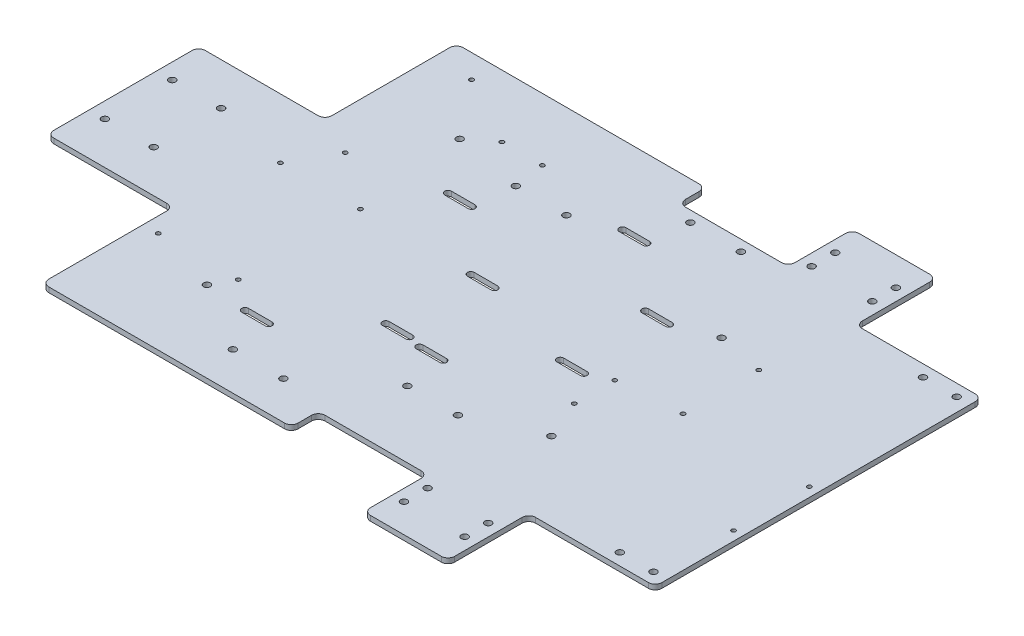
from build123d import *

# Parameters (mm, degrees)
SALIENTE_EXTRUIR1_DEPTH       = 3
REDONDEO1_R                   = 4
CROQUIS4_R                    = 2
CORTAR_EXTRUIR1_DEPTH         = 10
CROQUIS5_R                    = 2
CORTAR_EXTRUIR2_DEPTH         = 10
TALADRO_ROSCADO_M31_D         = 2.5
TALADRO_ROSCADO_M31_DEPTH     = 8.5
TALADRO_ROSCADO_M31_TIP       = 0.751075774
CROQUIS13_R                   = 2
CORTAR_EXTRUIR6_DEPTH         = 438.724799389
CROQUIS14_R                   = 2
CORTAR_EXTRUIR7_DEPTH         = 438.724799389
CORTAR_EXTRUIR9_DEPTH         = 438.724799389
TALADRO_ROSCADO_M32_D         = 2.5
TALADRO_ROSCADO_M32_DEPTH     = 8.5
TALADRO_ROSCADO_M32_TIP       = 0.751075774
TALADRO_ROSCADO_M33_OUTLINE_R = 1.25
TALADRO_ROSCADO_M33_DEPTH     = 3
CROQUIS22_R                   = 2
CORTAR_EXTRUIR10_DEPTH        = 438.724799389
CROQUIS23_R                   = 2
CORTAR_EXTRUIR11_DEPTH        = 438.724799389
TALADRO_ROSCADO_M34_OUTLINE_R = 1.25
TALADRO_ROSCADO_M34_DEPTH     = 3
CROQUIS26_R                   = 2
CORTAR_EXTRUIR12_DEPTH        = 438.724799389
TALADRO_ROSCADO_M35_OUTLINE_R = 1.25
TALADRO_ROSCADO_M35_DEPTH     = 3
CROQUIS31_R                   = 2
CORTAR_EXTRUIR13_DEPTH        = 438.724799389
CORTAR_EXTRUIR14_DEPTH        = 438.724799389


# Read off the part's stored shape, not the designer's step: Taladro roscado M33, Taladro roscado M34, Taladro roscado M35
with BuildPart() as part:
    # Croquis1 → Saliente-Extruir1 (new body)
    with BuildSketch(Plane(origin=(0, 0, 0), x_dir=(1, 0, 0), z_dir=(0, 1, 0))):
        Polygon((0, 0), (-413, 0), (-413, 45), (-338, 45), (-338, 123), (-190, 123), (-190, 107), (-125, 107), (-125, 145), (-75, 145), (-75, 97), (0, 97), align=None)
    saliente_extruir1 = extrude(amount=SALIENTE_EXTRUIR1_DEPTH)

    # Simetría1: Saliente-Extruir1 across plane
    add(saliente_extruir1.mirror(Plane(origin=(0, 3, 0), x_dir=(1, 0, 0), z_dir=(0, 0, -1))))

    # Redondeo1
    redondeo1_edges = [part.edges().sort_by_distance(p)[0] for p in [
        (-413, 1.5, -45),
        (-338, 1.5, -45),
        (-338, 1.5, -123),
        (-190, 1.5, -123),
        (-190, 1.5, -107),
        (-125, 1.5, -107),
        (-125, 1.5, -145),
        (-75, 1.5, -145),
        (-75, 1.5, -97),
        (0, 1.5, -97),
        (0, 1.5, 97),
        (-413, 1.5, 45),
        (-338, 1.5, 45),
        (-338, 1.5, 123),
        (-190, 1.5, 123),
        (-190, 1.5, 107),
        (-125, 1.5, 107),
        (-125, 1.5, 145),
        (-75, 1.5, 145),
        (-75, 1.5, 97),
    ]]
    fillet(redondeo1_edges, radius=REDONDEO1_R)

    # Croquis4 → Cortar-Extruir1 (cut)
    with BuildSketch(Plane(origin=(0, 3, 0), x_dir=(1, 0, 0), z_dir=(0, 1, 0))):
        with Locations(Location((-108.1, -50.5, 0), (0, 0, 270))):
            Circle(CROQUIS4_R)
    cortar_extruir1 = extrude(amount=-CORTAR_EXTRUIR1_DEPTH, mode=Mode.SUBTRACT)

    # Simetría2: Cortar-Extruir1 across plane
    add(cortar_extruir1.mirror(Plane.XY), mode=Mode.SUBTRACT)

    # Croquis5 → Cortar-Extruir2 (cut)
    with BuildSketch(Plane(origin=(0, 3, 0), x_dir=(1, 0, 0), z_dir=(0, 1, 0))):
        with Locations(Location((-288.1, -75, 0), (0, 0, 270))):
            Circle(CROQUIS5_R)
    cortar_extruir2 = extrude(amount=-CORTAR_EXTRUIR2_DEPTH, mode=Mode.SUBTRACT)

    # Simetría3: Cortar-Extruir2 across plane
    add(cortar_extruir2.mirror(Plane.XY), mode=Mode.SUBTRACT)

    # Taladro roscado M31
    with Locations(Plane(origin=(0, 3, 0), x_dir=(1, 0, 0), z_dir=(0, 1, 0))):
        with Locations((-329, 9.5), (-281.5, 9.5), (-281.5, -63), (-329, -63)):
            Hole(TALADRO_ROSCADO_M31_D / 2, depth=TALADRO_ROSCADO_M31_DEPTH)
            with Locations((0, 0, -(TALADRO_ROSCADO_M31_DEPTH + TALADRO_ROSCADO_M31_TIP / 2))):  # 118° drill point
                Cone(0, TALADRO_ROSCADO_M31_D / 2, TALADRO_ROSCADO_M31_TIP, mode=Mode.SUBTRACT)

    # Croquis13 → Cortar-Extruir6 (cut, through all)
    with BuildSketch(Plane(origin=(0, 3, 0), x_dir=(1, 0, 0), z_dir=(0, 1, 0))):
        with Locations(Location((-8, -90, 0), (0, 0, 270))):
            Circle(CROQUIS13_R)
    cortar_extruir6 = extrude(amount=-CORTAR_EXTRUIR6_DEPTH, mode=Mode.SUBTRACT)

    # Croquis14 → Cortar-Extruir7 (cut, through all)
    with BuildSketch(Plane(origin=(0, 3, 0), x_dir=(1, 0, 0), z_dir=(0, 1, 0))):
        with Locations(Location((-28, -90, 0), (0, 0, 270))):
            Circle(CROQUIS14_R)
    cortar_extruir7 = extrude(amount=-CORTAR_EXTRUIR7_DEPTH, mode=Mode.SUBTRACT)

    # Croquis16 → Cortar-Extruir9 (cut, through all)
    with BuildSketch(Plane(origin=(0, 3, 0), x_dir=(1, 0, 0), z_dir=(0, 1, 0))):
        with BuildLine():
            Line((-263.7, 41.75), (-249.7, 41.75))
            ThreePointArc((-249.7, 41.75), (-247.7, 43.75), (-249.7, 45.75))
            Line((-249.7, 45.75), (-263.7, 45.75))
            ThreePointArc((-263.7, 45.75), (-265.7, 43.75), (-263.7, 41.75))
        make_face()
        with BuildLine():
            Line((-263.7, -78.75), (-249.7, -78.75))
            ThreePointArc((-249.7, -78.75), (-247.7, -76.75), (-249.7, -74.75))
            Line((-249.7, -74.75), (-263.7, -74.75))
            ThreePointArc((-263.7, -74.75), (-265.7, -76.75), (-263.7, -78.75))
        make_face()
        with BuildLine():
            Line((-215.2, -43.75), (-201.2, -43.75))
            ThreePointArc((-201.2, -43.75), (-199.2, -41.75), (-201.2, -39.75))
            Line((-201.2, -39.75), (-215.2, -39.75))
            ThreePointArc((-215.2, -39.75), (-217.2, -41.75), (-215.2, -43.75))
        make_face()
        with BuildLine():
            Line((-144.61, -10.75), (-130.61, -10.75))
            ThreePointArc((-130.61, -10.75), (-128.61, -8.75), (-130.61, -6.75))
            Line((-130.61, -6.75), (-144.61, -6.75))
            ThreePointArc((-144.61, -6.75), (-146.61, -8.75), (-144.61, -10.75))
        make_face()
        with BuildLine():
            Line((-144.61, 39.75), (-130.61, 39.75))
            ThreePointArc((-130.61, 39.75), (-128.61, 41.75), (-130.61, 43.75))
            Line((-130.61, 43.75), (-144.61, 43.75))
            ThreePointArc((-144.61, 43.75), (-146.61, 41.75), (-144.61, 39.75))
        make_face()
        with BuildLine():
            Line((-193.11, 74.75), (-179.11, 74.75))
            ThreePointArc((-179.11, 74.75), (-177.11, 76.75), (-179.11, 78.75))
            Line((-179.11, 78.75), (-193.11, 78.75))
            ThreePointArc((-193.11, 78.75), (-195.11, 76.75), (-193.11, 74.75))
        make_face()
    extrude(amount=-CORTAR_EXTRUIR9_DEPTH, mode=Mode.SUBTRACT)

    # Taladro roscado M32
    with Locations(Plane(origin=(0, 3, 0), x_dir=(1, 0, 0), z_dir=(0, 1, 0))):
        with Locations((-315, 34), (-315, 109)):
            Hole(TALADRO_ROSCADO_M32_D / 2, depth=TALADRO_ROSCADO_M32_DEPTH)
            with Locations((0, 0, -(TALADRO_ROSCADO_M32_DEPTH + TALADRO_ROSCADO_M32_TIP / 2))):  # 118° drill point
                Cone(0, TALADRO_ROSCADO_M32_D / 2, TALADRO_ROSCADO_M32_TIP, mode=Mode.SUBTRACT)

    # Taladro roscado M33 outline → Taladro roscado M33 (cut)
    with BuildSketch(Plane(origin=(0, 0, 0), x_dir=(1, 0, 0), z_dir=(0, 1, 0))):
        with Locations((-250, 86)):
            Circle(TALADRO_ROSCADO_M33_OUTLINE_R)
        with Locations((-274, 86)):
            Circle(TALADRO_ROSCADO_M33_OUTLINE_R)
    extrude(amount=TALADRO_ROSCADO_M33_DEPTH, mode=Mode.SUBTRACT)

    # Croquis22 → Cortar-Extruir10 (cut, through all)
    with BuildSketch(Plane(origin=(0, 3, 0), x_dir=(1, 0, 0), z_dir=(0, 1, 0))):
        with Locations(Location((-247.2, 67.5, 0), (0, 0, 270))):
            Circle(CROQUIS22_R)
        with Locations(Location((-217.2, 67.5, 0), (0, 0, 270))):
            Circle(CROQUIS22_R)
        with Locations(Location((-217.2, -100.5, 0), (0, 0, 270))):
            Circle(CROQUIS22_R)
        with Locations(Location((-247.2, -100.5, 0), (0, 0, 270))):
            Circle(CROQUIS22_R)
    extrude(amount=-CORTAR_EXTRUIR10_DEPTH, mode=Mode.SUBTRACT)

    # Croquis23 → Cortar-Extruir11 (cut, through all)
    with BuildSketch(Plane(origin=(0, 3, 0), x_dir=(1, 0, 0), z_dir=(0, 1, 0))):
        with Locations(Location((-176.61, 100.5, 0), (0, 0, 270))):
            Circle(CROQUIS23_R)
        with Locations(Location((-146.61, 100.5, 0), (0, 0, 270))):
            Circle(CROQUIS23_R)
        with Locations(Location((-146.61, -67.5, 0), (0, 0, 270))):
            Circle(CROQUIS23_R)
        with Locations(Location((-176.61, -67.5, 0), (0, 0, 270))):
            Circle(CROQUIS23_R)
    extrude(amount=-CORTAR_EXTRUIR11_DEPTH, mode=Mode.SUBTRACT)

    # Taladro roscado M34 outline → Taladro roscado M34 (cut)
    with BuildSketch(Plane(origin=(0, 0, 0), x_dir=(1, 0, 0), z_dir=(0, 1, 0))):
        with Locations((-118, -27)):
            Circle(TALADRO_ROSCADO_M34_OUTLINE_R)
        with Locations((-118, -3)):
            Circle(TALADRO_ROSCADO_M34_OUTLINE_R)
    extrude(amount=TALADRO_ROSCADO_M34_DEPTH, mode=Mode.SUBTRACT)

    # Croquis26 → Cortar-Extruir12 (cut, through all)
    with BuildSketch(Plane(origin=(0, 3, 0), x_dir=(1, 0, 0), z_dir=(0, 1, 0))):
        with Locations(Location((-118.122816505, -114, 0), (0, 0, 270))):
            Circle(CROQUIS26_R)
        with Locations(Location((-82.122816505, -114, 0), (0, 0, 270))):
            Circle(CROQUIS26_R)
        with Locations(Location((-82.122816505, -128, 0), (0, 0, 270))):
            Circle(CROQUIS26_R)
        with Locations(Location((-118.122816505, -128, 0), (0, 0, 270))):
            Circle(CROQUIS26_R)
    cortar_extruir12 = extrude(amount=-CORTAR_EXTRUIR12_DEPTH, mode=Mode.SUBTRACT)

    # Simetría4: Cortar-Extruir12 across plane
    add(cortar_extruir12.mirror(Plane.XY), mode=Mode.SUBTRACT)

    # Taladro roscado M35 outline → Taladro roscado M35 (cut)
    with BuildSketch(Plane(origin=(0, 0, 0), x_dir=(1, 0, 0), z_dir=(0, 1, 0))):
        with Locations((-5.5, 0)):
            Circle(TALADRO_ROSCADO_M35_OUTLINE_R)
        with Locations((-5.5, -45)):
            Circle(TALADRO_ROSCADO_M35_OUTLINE_R)
        with Locations((-80.5, 0)):
            Circle(TALADRO_ROSCADO_M35_OUTLINE_R)
        with Locations((-80.5, 45)):
            Circle(TALADRO_ROSCADO_M35_OUTLINE_R)
    extrude(amount=TALADRO_ROSCADO_M35_DEPTH, mode=Mode.SUBTRACT)

    # Simetría5: Cortar-Extruir6, Cortar-Extruir7 across plane
    add(cortar_extruir6.mirror(Plane.XY), mode=Mode.SUBTRACT)
    add(cortar_extruir7.mirror(Plane.XY), mode=Mode.SUBTRACT)

    # Croquis31 → Cortar-Extruir13 (cut, through all)
    with BuildSketch(Plane(origin=(0, 3, 0), x_dir=(1, 0, 0), z_dir=(0, 1, 0))):
        with Locations(Location((-403.7, 20, 0), (0, 0, 270))):
            Circle(CROQUIS31_R)
        with Locations(Location((-374.7, 20, 0), (0, 0, 270))):
            Circle(CROQUIS31_R)
    cortar_extruir13 = extrude(amount=-CORTAR_EXTRUIR13_DEPTH, mode=Mode.SUBTRACT)

    # Simetría6: Cortar-Extruir13 across plane
    add(cortar_extruir13.mirror(Plane.XY), mode=Mode.SUBTRACT)

    # Croquis32 → Cortar-Extruir14 (cut, through all)
    with BuildSketch(Plane.XZ):
        with BuildLine():
            Line((-185.11, 41.75), (-193.11, 41.75))
            ThreePointArc((-193.11, 41.75), (-195.11, 43.75), (-193.11, 45.75))
            Line((-193.11, 45.75), (-185.11, 45.75))
            Line((-185.11, 45.75), (-179.11, 45.75))
            ThreePointArc((-179.11, 45.75), (-177.11, 43.75), (-179.11, 41.75))
            Line((-179.11, 41.75), (-185.11, 41.75))
        make_face()
        with BuildLine():
            Line((-207.2, -10.75), (-215.2, -10.75))
            ThreePointArc((-215.2, -10.75), (-217.2, -8.75), (-215.2, -6.75))
            Line((-215.2, -6.75), (-207.2, -6.75))
            Line((-207.2, -6.75), (-201.2, -6.75))
            ThreePointArc((-201.2, -6.75), (-199.2, -8.75), (-201.2, -10.75))
            Line((-201.2, -10.75), (-207.2, -10.75))
        make_face()
    extrude(amount=-CORTAR_EXTRUIR14_DEPTH, mode=Mode.SUBTRACT)


solid = part.part
